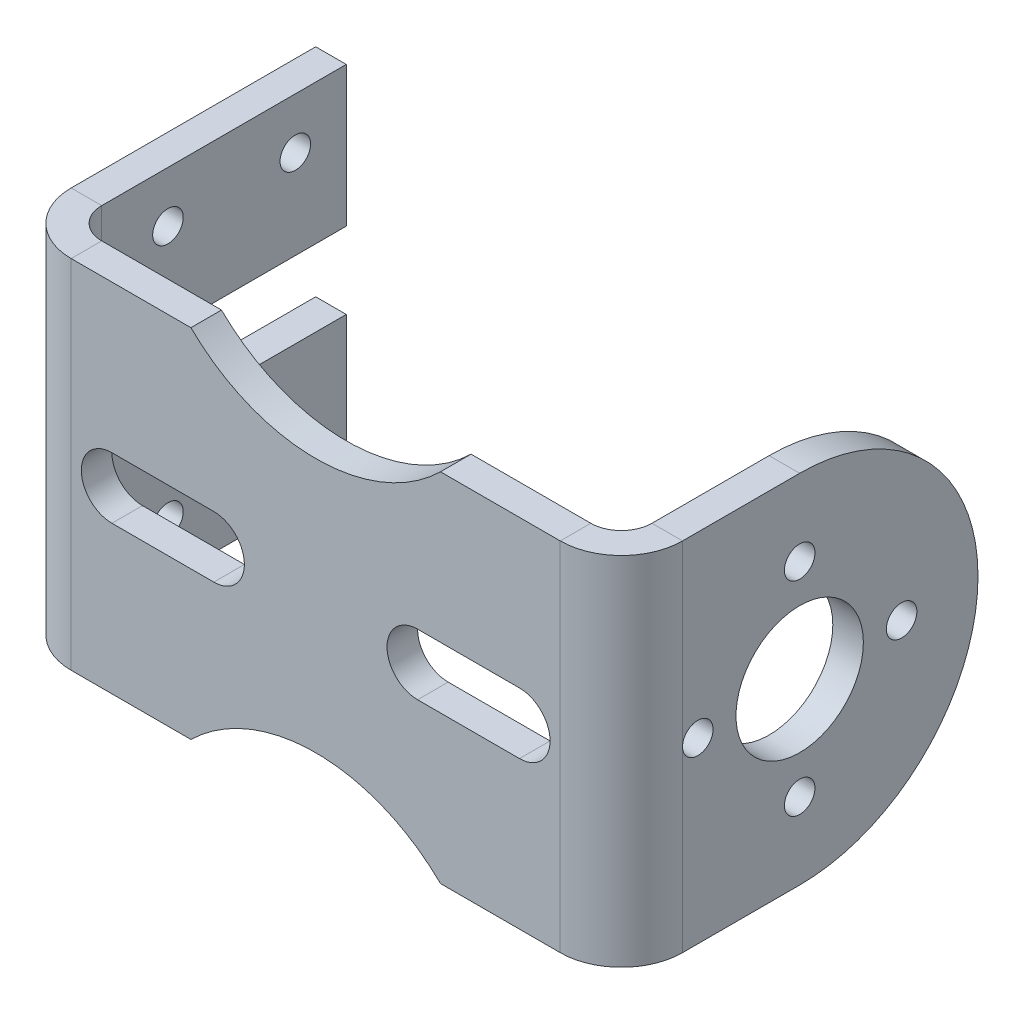
from build123d import *

# Parameters (mm, degrees)
SKETCH1_W                    = 108
SKETCH1_H                    = 70
BASE_FLANGE1_DEPTH           = 6
EDGE_FLANGE1_STRIP_W         = 36
EDGE_FLANGE1_STRIP_H         = 6
EDGE_FLANGE1_STRIP_CUT_DEPTH = 70
EDGE_FLANGE1_DEPTH           = 70
EDGE_FLANGE2_STRIP_W         = 36
EDGE_FLANGE2_STRIP_H         = 6
EDGE_FLANGE2_STRIP_CUT_DEPTH = 70
EDGE_FLANGE2_DEPTH           = 70
FILLET1_R                    = 35
CUT_EXTRUDE1_DEPTH           = 6
SKETCH15_R                   = 3
CUT_EXTRUDE2_DEPTH           = 7
LPATTERN1_COUNT              = 2
LPATTERN1_PITCH              = 50
CUT_EXTRUDE3_DEPTH           = 7
LPATTERN2_COUNT              = 2
LPATTERN2_PITCH              = 60
CUT_EXTRUDE4_DEPTH           = 8
SKETCH27_R                   = 3
CUT_EXTRUDE6_DEPTH           = 8
HOLE2_START                  = 54
HOLE2_OUTLINE_R              = 12.5
HOLE2_DEPTH                  = 6


# Read off the part's stored shape, not the designer's step: Hole2
# Sheet-metal steps are written as plain solids
with BuildPart() as part:
    # Sketch1 → Base-Flange1 (new body)
    with BuildSketch(Plane.XY):
        Rectangle(SKETCH1_W, SKETCH1_H)
    extrude(amount=-BASE_FLANGE1_DEPTH)

    # Edge-Flange1 strip (across the edge) → Edge-Flange1 strip cut (cut)
    with BuildSketch(Plane(origin=(54, 35, -6), x_dir=(-1, 0, 0), z_dir=(0, -1, 0))):
        with Locations((-12, -3)):
            Rectangle(EDGE_FLANGE1_STRIP_W, EDGE_FLANGE1_STRIP_H)
    extrude(amount=EDGE_FLANGE1_STRIP_CUT_DEPTH, mode=Mode.SUBTRACT)

    # Edge-Flange1 section (across the edge) → Edge-Flange1 (add)
    with BuildSketch(Plane(origin=(54, 35, -6), x_dir=(-1, 0, 0), z_dir=(0, -1, 0))):
        with BuildLine():
            Line((-6, 6), (-6, 64))
            Line((-6, 64), (0, 64))
            Line((0, 64), (0, 6))
            ThreePointArc((0, 6), (1.757359313, 1.757359313), (6, 0))
            Line((6, 0), (6, -6))
            ThreePointArc((6, -6), (-2.485281374, -2.485281374), (-6, 6))
        make_face()
    extrude(amount=EDGE_FLANGE1_DEPTH)

    # Edge-Flange2 strip (across the edge) → Edge-Flange2 strip cut (cut)
    with BuildSketch(Plane(origin=(-54, -35, -6), x_dir=(1, 0, 0), z_dir=(0, 1, 0))):
        with Locations((-12, -3)):
            Rectangle(EDGE_FLANGE2_STRIP_W, EDGE_FLANGE2_STRIP_H)
    extrude(amount=EDGE_FLANGE2_STRIP_CUT_DEPTH, mode=Mode.SUBTRACT)

    # Edge-Flange2 section (across the edge) → Edge-Flange2 (add)
    with BuildSketch(Plane(origin=(-54, -35, -6), x_dir=(1, 0, 0), z_dir=(0, 1, 0))):
        with BuildLine():
            Line((-6, 6), (-6, 54))
            Line((-6, 54), (0, 54))
            Line((0, 54), (0, 6))
            ThreePointArc((0, 6), (1.757359313, 1.757359313), (6, 0))
            Line((6, 0), (6, -6))
            ThreePointArc((6, -6), (-2.485281374, -2.485281374), (-6, 6))
        make_face()
    extrude(amount=EDGE_FLANGE2_DEPTH)

    # Fillet1
    fillet1_edges = [part.edges().sort_by_distance(p)[0] for p in [
        (57, -35, -70),
        (57, 35, -70),
    ]]
    fillet(fillet1_edges, radius=FILLET1_R - 0.0001)  # a hair under: the kernel refuses the full size

    # Sketch14 → Cut-Extrude1 (cut)
    with BuildSketch(Plane.ZY.offset(60)):
        with BuildLine():
            Line((-60, 7.5), (-60, -7.5))
            Line((-60, -7.5), (-25, -7.5))
            ThreePointArc((-25, -7.5), (-17.5, 0), (-25, 7.5))
            Line((-25, 7.5), (-60, 7.5))
        make_face()
    extrude(amount=-CUT_EXTRUDE1_DEPTH, mode=Mode.SUBTRACT)

    # Sketch15 → Cut-Extrude2 (cut)
    with BuildSketch(Plane.ZY.offset(60)):
        with Locations((-50, 25)):
            Circle(SKETCH15_R)
        with Locations((-25, 25)):
            Circle(SKETCH15_R)
    cut_extrude2 = extrude(amount=-CUT_EXTRUDE2_DEPTH, mode=Mode.SUBTRACT)

    # LPattern1: Cut-Extrude2 ×2
    with Locations(*[(0, -i * LPATTERN1_PITCH, 0) for i in range(1, LPATTERN1_COUNT)]):
        add(cut_extrude2, mode=Mode.SUBTRACT)

    # Sketch16 → Cut-Extrude3 (cut)
    with BuildSketch(Plane(origin=(0, 0, -6), x_dir=(-1, 0, 0), z_dir=(0, 0, -1))):
        with BuildLine():
            Line((-40, 6), (-20, 6))
            ThreePointArc((-20, 6), (-14, 0), (-20, -6))
            Line((-20, -6), (-40, -6))
            ThreePointArc((-40, -6), (-46, 0), (-40, 6))
        make_face()
    cut_extrude3 = extrude(amount=-CUT_EXTRUDE3_DEPTH, mode=Mode.SUBTRACT)

    # LPattern2: Cut-Extrude3 ×2
    with Locations(*[(-i * LPATTERN2_PITCH, 0, 0) for i in range(1, LPATTERN2_COUNT)]):
        add(cut_extrude3, mode=Mode.SUBTRACT)

    # Sketch18 → Cut-Extrude4 (cut)
    with BuildSketch(Plane(origin=(0, 0, -6), x_dir=(-1, 0, 0), z_dir=(0, 0, -1))):
        with BuildLine():
            Line((24.494897428, -35), (-24.494897428, -35))
            ThreePointArc((-24.494897428, -35), (0, -25), (24.494897428, -35))
        make_face()
    cut_extrude4 = extrude(amount=-CUT_EXTRUDE4_DEPTH, mode=Mode.SUBTRACT)

    # Sketch27 → Cut-Extrude6 (cut)
    with BuildSketch(Plane(origin=(60, 0, 0), x_dir=(0, 0, -1), z_dir=(1, 0, 0))):
        with Locations((55, 0)):
            Circle(SKETCH27_R)
        with Locations((35, 20)):
            Circle(SKETCH27_R)
        with Locations(Location((15, 0, 0), (0, 0, 180))):
            Circle(SKETCH27_R)
        with Locations((35, -20)):
            Circle(SKETCH27_R)
    extrude(amount=-CUT_EXTRUDE6_DEPTH, mode=Mode.SUBTRACT)

    # Hole2 outline → Hole2 (cut)
    with BuildSketch(Plane.YZ.offset(HOLE2_START)):
        with Locations((0, -35)):
            Circle(HOLE2_OUTLINE_R)
    extrude(amount=HOLE2_DEPTH, mode=Mode.SUBTRACT)

    # Mirror2: Cut-Extrude4 across plane
    add(cut_extrude4.mirror(Plane.ZX), mode=Mode.SUBTRACT)


solid = part.part
